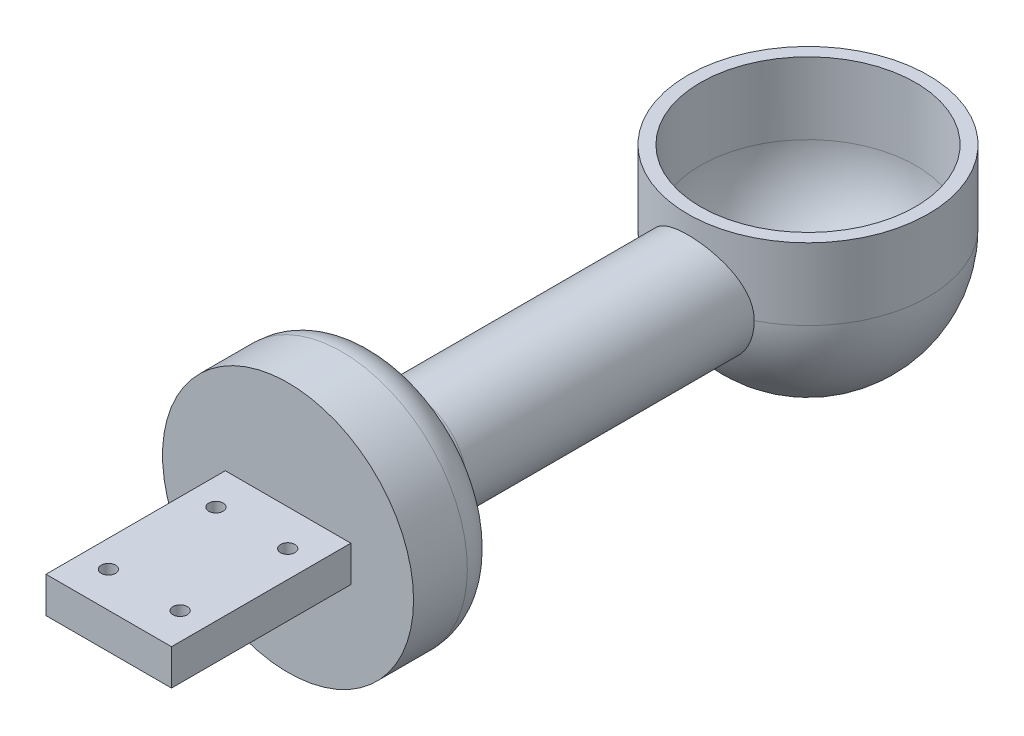
from build123d import *

# Parameters (mm, degrees)
SKETCH1_R                 = 35
BOSS_EXTRUDE1_DEPTH       = 25
SKETCH2_R                 = 15
BOSS_EXTRUDE2_DEPTH       = 90
FILLET1_R                 = 10
SKETCH3_W                 = 35
SKETCH3_H                 = 50
SKETCH3_R                 = 2
BOSS_EXTRUDE3_DEPTH       = 5
REVOLVE1_ANGLE            = 180
BOSS_EXTRUDE4_OUTLINE_R   = 33.541019662
BOSS_EXTRUDE4_OUTLINE_R_2 = 30
BOSS_EXTRUDE4_DEPTH       = 20


# Read off the part's stored shape, not the designer's step: Boss-Extrude4
with BuildPart() as part:
    # Sketch1 → Boss-Extrude1 (new body)
    with BuildSketch(Plane.XY):
        Circle(SKETCH1_R)
    extrude(amount=BOSS_EXTRUDE1_DEPTH)

    # Sketch2 → Boss-Extrude2 (add)
    with BuildSketch(Plane(origin=(0, 0, 0), x_dir=(-1, 0, 0), z_dir=(0, 0, -1))):
        with Locations(Location((0, 0, 0), (0, 0, 180))):
            Circle(SKETCH2_R)
    extrude(amount=BOSS_EXTRUDE2_DEPTH)

    # Fillet1
    fillet1_edges = [part.edges().sort_by_distance(p)[0] for p in [
        (-35, 0, 0),
        (-15, 0, 0),
    ]]
    fillet(fillet1_edges, radius=FILLET1_R - 0.0001)  # a hair under: the kernel refuses the full size

    # Sketch3 → Boss-Extrude3 (add, symmetric)
    with BuildSketch(Plane(origin=(0, 0, 0), x_dir=(1, 0, 0), z_dir=(0, 1, 0))):
        with Locations((0, -50)):
            Rectangle(SKETCH3_W, SKETCH3_H)
        with Locations(Location((-10, -35.1, 0), (0, 0, 270))):
            Circle(SKETCH3_R, mode=Mode.SUBTRACT)
        with Locations(Location((10, -35.1, 0), (0, 0, 270))):
            Circle(SKETCH3_R, mode=Mode.SUBTRACT)
        with Locations(Location((10, -65.1, 0), (0, 0, 270))):
            Circle(SKETCH3_R, mode=Mode.SUBTRACT)
        with Locations(Location((-10, -65.1, 0), (0, 0, 270))):
            Circle(SKETCH3_R, mode=Mode.SUBTRACT)
    extrude(amount=BOSS_EXTRUDE3_DEPTH, both=True)

    # Sketch4 → Revolve1 (revolve)
    with BuildSketch(Plane(origin=(0, 0, 0), x_dir=(1, 0, 0), z_dir=(0, 1, 0))):
        with BuildLine():
            Line((0, 150), (0, 153.541019662))
            ThreePointArc((0, 153.541019662), (-33.541019662, 120), (0, 86.458980338))
            Line((0, 86.458980338), (0, 90))
            ThreePointArc((0, 90), (-30, 120), (0, 150))
        make_face()
    revolve(axis=Axis((0, 0, -90), (0, 0, 1)), revolution_arc=REVOLVE1_ANGLE)

    # Boss-Extrude4 outline → Boss-Extrude4 (add)
    with BuildSketch(Plane(origin=(0, 0, 0), x_dir=(1, 0, 0), z_dir=(0, 1, 0))):
        with Locations((0, 120)):
            Circle(BOSS_EXTRUDE4_OUTLINE_R)
        with Locations((0, 120)):
            Circle(BOSS_EXTRUDE4_OUTLINE_R_2, mode=Mode.SUBTRACT)
    extrude(amount=BOSS_EXTRUDE4_DEPTH)


solid = part.part
